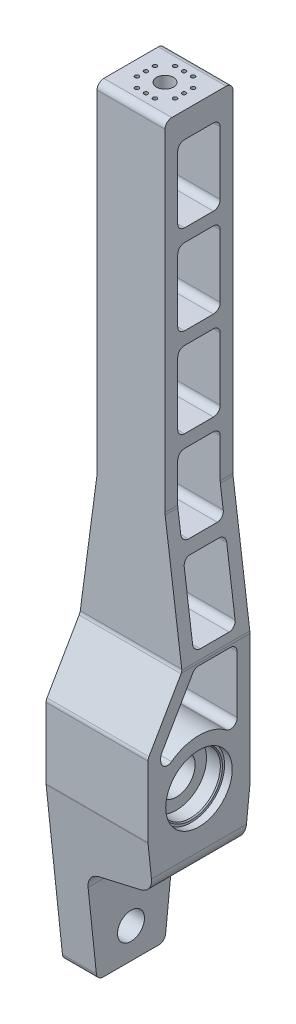
from build123d import *

# Parameters (mm, degrees)
SKETCH5_W                   = 38.1
SKETCH5_H                   = 298.45
BOSS_EXTRUDE2_DEPTH         = 19.05
F_3_8_CLEARANCE_HOLE2_D     = 10.0838
F_3_8_CLEARANCE_HOLE4_D     = 13.97
BODY_MOVE_COPY4_ANGLE       = 90
CUT_EXTRUDE7_DEPTH          = 218.574389578
CUT_EXTRUDE7_DEPTH_BACK     = 218.574389578
CUT_EXTRUDE1_DEPTH          = 218.574389578
CUT_EXTRUDE1_DEPTH_BACK     = 218.574389578
CUT_EXTRUDE5_DEPTH          = 218.574389578
CUT_EXTRUDE5_DEPTH_BACK     = 218.574389578
CUT_EXTRUDE8_DEPTH          = 218.574389578
CUT_EXTRUDE8_DEPTH_BACK     = 218.574389578
EXTRUDE_THIN1_DEPTH         = 19.05
EXTRUDE_THIN1_DEPTH_BACK    = 19.05
SKETCH27_W                  = 15.875
SKETCH27_H                  = 4.7625
CUT_EXTRUDE9_DEPTH          = 218.574389578
SKETCH31_R                  = 0.735
CUT_EXTRUDE10_DEPTH         = 12.7
CIRPATTERN1_COUNT           = 4
CIRPATTERN1_COPY_1_SKETCH_R = 0.735
CIRPATTERN1_COPY_1_DEPTH    = 12.7
CIRPATTERN1_COPY_2_SKETCH_R = 0.735
CIRPATTERN1_COPY_2_DEPTH    = 12.7
CIRPATTERN1_COPY_3_SKETCH_R = 0.735
CIRPATTERN1_COPY_3_DEPTH    = 12.7
CIRPATTERN1_COPY_4_SKETCH_R = 0.735
CIRPATTERN1_COPY_4_DEPTH    = 12.7
CIRPATTERN1_COPY_5_SKETCH_R = 0.735
CIRPATTERN1_COPY_5_DEPTH    = 12.7
CIRPATTERN1_COPY_6_SKETCH_R = 0.735
CIRPATTERN1_COPY_6_DEPTH    = 12.7
CUT_EXTRUDE11_REACH         = 287.715
SKETCH33_R                  = 3.175
FILLET4_R                   = 2.54
FILLET3_R                   = 6.35
FILLET5_R                   = 2.54


with BuildPart() as part:
    # Sketch5 → Boss-Extrude2 (new, symmetric)
    with BuildSketch(Plane.XY):
        with Locations((0, 66.675)):
            Rectangle(SKETCH5_W, SKETCH5_H)
    extrude(amount=BOSS_EXTRUDE2_DEPTH, both=True)

    # 3/8 Clearance Hole2 (through all)
    with Locations(Plane(origin=(19.05, 0, 0), x_dir=(0, 0, -1), z_dir=(1, 0, 0))):
        with Locations((0, -57.15)):
            Hole(F_3_8_CLEARANCE_HOLE2_D / 2)

    # 3/8 Clearance Hole4 (through all)
    with Locations(Plane(origin=(19.05, 0, 0), x_dir=(0, 0, -1), z_dir=(1, 0, 0))):
        with Locations((0, 0)):
            Hole(F_3_8_CLEARANCE_HOLE4_D / 2)


with BuildPart() as body_2:
    # uxcell-FR6ZZ: read off the stored shape, not the designer's step
    # uxcell-FR6ZZ outline → uxcell-FR6ZZ (revolve)
    with BuildSketch(Plane(origin=(46.870492888, 0, -67.456601715), x_dir=(1, 0, 0), z_dir=(0, 0, 1))):
        Polygon((12.430125, 146.229545606), (4.7625, 146.229545606), (4.7625, 137.815795606), (11.2395, 137.815795606), (11.2395, 142.975170606), (11.636375, 143.372045606), (12.430125, 143.372045606), align=None)
    revolve(axis=Axis((46.870492888, 0, -67.456601715), (0, 1, 0)))


with BuildPart() as body_2_1:
    # Body-Move/Copy4: read off the stored shape, not the designer's step
    # Body-Move/Copy4: moved
    add(body_2.part.moved(Location((-46.8704929, -127.1795456, 67.4566017))).rotate(Axis((0, 0, 0), (0, 0, -1)), BODY_MOVE_COPY4_ANGLE))


with BuildPart() as body_3:
    # Mirror1: mirrored copy
    add(body_2_1.part.mirror(Plane(origin=(0, 0, 0), x_dir=(0, 0, 1), z_dir=(1, 0, 0))))


with BuildPart() as part_1:
    add(part.part)

    # Combine2: cut body 3, body 2
    add(body_3.part, mode=Mode.SUBTRACT)
    add(body_2_1.part, mode=Mode.SUBTRACT)

    # Sketch24 → Cut-Extrude7 (cut, two sides: drawn at the far end of the back side and taken through both)
    with BuildSketch(Plane(origin=(0, 0, 0), x_dir=(0, 0, -1), z_dir=(1, 0, 0)).offset(-CUT_EXTRUDE7_DEPTH_BACK)):
        Polygon((-6.35, 824.957801886), (-6.35, 215.9), (-6.35, 41.047045256), (-19.05, 19.05), (-323.578900943, -508.409528806), (-1508.617276964, -226.470401495), (-1191.388376021, 1106.896929197), align=None)
    extrude(amount=CUT_EXTRUDE7_DEPTH + CUT_EXTRUDE7_DEPTH_BACK, mode=Mode.SUBTRACT)

    # Sketch11 → Cut-Extrude1 (cut, two sides: drawn at the far end of the back side and taken through both)
    with BuildSketch(Plane.XY.offset(-CUT_EXTRUDE1_DEPTH_BACK)):
        Polygon((-6.35, -691.607801887), (-6.35, -82.55), (-6.35, -31.75), (19.05, -25.4), (609.922858655, 122.318214664), (1581.067185153, -612.994182394), (964.794326498, -1426.920198945), align=None)
    extrude(amount=CUT_EXTRUDE1_DEPTH + CUT_EXTRUDE1_DEPTH_BACK, mode=Mode.SUBTRACT)

    # Sketch18 → Cut-Extrude5 (cut, two sides: drawn at the far end of the back side and taken through both)
    with BuildSketch(Plane(origin=(0, 0, 0), x_dir=(0, 0, -1), z_dir=(1, 0, 0)).offset(-CUT_EXTRUDE5_DEPTH_BACK)):
        Polygon((-67.601886726, 453.814659538), (-19.05, -8.125685716), (-12.7, -68.5419), (12.7, -68.5419), (19.05, -8.125685716), (67.601886726, 453.814659538), (67.601886726, -475.155024096), (-67.601886726, -475.155024096), align=None)
    extrude(amount=CUT_EXTRUDE5_DEPTH + CUT_EXTRUDE5_DEPTH_BACK, mode=Mode.SUBTRACT)

    # Sketch25 → Cut-Extrude8 (cut, two sides: drawn at the far end of the back side and taken through both)
    with BuildSketch(Plane(origin=(0, 0, 0), x_dir=(0, 0, -1), z_dir=(1, 0, 0)).offset(-CUT_EXTRUDE8_DEPTH_BACK)):
        with BuildLine():
            Line((14.2875, 206.375), (-1.5875, 206.375))
            Line((-1.5875, 206.375), (-1.5875, 39.770937227))
            Line((-1.5875, 39.770937227), (-14.2875, 17.773891971))
            Line((-14.2875, 17.773891971), (-14.2875, 9.563142692))
            ThreePointArc((-14.2875, 9.563142692), (0, 17.192625), (14.2875, 9.563142692))
            Line((14.2875, 9.563142692), (14.2875, 206.375))
        make_face()
    extrude(amount=CUT_EXTRUDE8_DEPTH + CUT_EXTRUDE8_DEPTH_BACK, mode=Mode.SUBTRACT)

    # Sketch27 → Extrude-Thin1 (add, two sides: drawn at the far end of the back side and taken through both)
    with BuildSketch(Plane(origin=(0, 0, 0), x_dir=(0, 0, -1), z_dir=(1, 0, 0)).offset(-EXTRUDE_THIN1_DEPTH_BACK)):
        with Locations((6.35, 175.435437445)):
            Rectangle(SKETCH27_W, SKETCH27_H)
        with Locations((6.35, 142.114624891)):
            Rectangle(SKETCH27_W, SKETCH27_H)
        with Locations((6.35, 108.793812336)):
            Rectangle(SKETCH27_W, SKETCH27_H)
        with Locations((6.35, 75.472999782)):
            Rectangle(SKETCH27_W, SKETCH27_H)
        with Locations((6.35, 42.152187227)):
            Rectangle(SKETCH27_W, SKETCH27_H)
    extrude(amount=EXTRUDE_THIN1_DEPTH + EXTRUDE_THIN1_DEPTH_BACK)

    # Sketch28 → Cut-Extrude9 (cut, symmetric)
    with BuildSketch(Plane.XY):
        Polygon((-12.7, 798.316830556), (-12.7, 215.9), (-12.7, 88.9), (-19.05, 41.047045256), (-95.664055935, -536.308695123), (-1258.253635766, -464.038874806), (-1175.289579831, 870.586650873), align=None)
    cut_extrude9 = extrude(amount=CUT_EXTRUDE9_DEPTH, both=True, mode=Mode.SUBTRACT)

    # Mirror2: Cut-Extrude9 across plane
    add(cut_extrude9.mirror(Plane(origin=(0, 0, 0), x_dir=(0, 0, 1), z_dir=(1, 0, 0))), mode=Mode.SUBTRACT)

    # Sketch31 → Cut-Extrude10 (cut)
    with BuildSketch(Plane(origin=(0, 215.9, 0), x_dir=(1, 0, 0), z_dir=(0, 1, 0))):
        with Locations(Location((-3.375, 13.475, 0), (0, 0, 180))):
            Circle(SKETCH31_R)
    cut_extrude10 = extrude(amount=-CUT_EXTRUDE10_DEPTH, mode=Mode.SUBTRACT)

    # Sketch-Pattern1: Cut-Extrude10 at 2 more places
    with Locations((3.375, 0, 0), (6.75, 0, 0)):
        add(cut_extrude10, mode=Mode.SUBTRACT)

    # CirPattern1: Cut-Extrude10 ×4 about axis
    cirpattern1_axis = Axis((0, 0, -6.35), (0, 1, 0))
    for i in range(1, CIRPATTERN1_COUNT):
        add(cut_extrude10.rotate(cirpattern1_axis, i * 360 / CIRPATTERN1_COUNT), mode=Mode.SUBTRACT)

    # CirPattern1 copy 1 sketch → CirPattern1 copy 1 (cut)
    with BuildSketch(Plane(origin=(6.35, 215.9, -9.725), x_dir=(0, 0, -1), z_dir=(0, 1, 0))):
        with Locations(Location((-3.375, 13.475, 0), (0, 0, 180))):
            Circle(CIRPATTERN1_COPY_1_SKETCH_R)
    extrude(amount=-CIRPATTERN1_COPY_1_DEPTH, mode=Mode.SUBTRACT)

    # CirPattern1 copy 2 sketch → CirPattern1 copy 2 (cut)
    with BuildSketch(Plane(origin=(-3.375, 215.9, -12.7), x_dir=(-1, 0, 0), z_dir=(0, 1, 0))):
        with Locations(Location((-3.375, 13.475, 0), (0, 0, 180))):
            Circle(CIRPATTERN1_COPY_2_SKETCH_R)
    extrude(amount=-CIRPATTERN1_COPY_2_DEPTH, mode=Mode.SUBTRACT)

    # CirPattern1 copy 3 sketch → CirPattern1 copy 3 (cut)
    with BuildSketch(Plane(origin=(-6.35, 215.9, -2.975), x_dir=(0, 0, 1), z_dir=(0, 1, 0))):
        with Locations(Location((-3.375, 13.475, 0), (0, 0, 180))):
            Circle(CIRPATTERN1_COPY_3_SKETCH_R)
    extrude(amount=-CIRPATTERN1_COPY_3_DEPTH, mode=Mode.SUBTRACT)

    # CirPattern1 copy 4 sketch → CirPattern1 copy 4 (cut)
    with BuildSketch(Plane(origin=(6.35, 215.9, -13.1), x_dir=(0, 0, -1), z_dir=(0, 1, 0))):
        with Locations(Location((-3.375, 13.475, 0), (0, 0, 180))):
            Circle(CIRPATTERN1_COPY_4_SKETCH_R)
    extrude(amount=-CIRPATTERN1_COPY_4_DEPTH, mode=Mode.SUBTRACT)

    # CirPattern1 copy 5 sketch → CirPattern1 copy 5 (cut)
    with BuildSketch(Plane(origin=(-6.75, 215.9, -12.7), x_dir=(-1, 0, 0), z_dir=(0, 1, 0))):
        with Locations(Location((-3.375, 13.475, 0), (0, 0, 180))):
            Circle(CIRPATTERN1_COPY_5_SKETCH_R)
    extrude(amount=-CIRPATTERN1_COPY_5_DEPTH, mode=Mode.SUBTRACT)

    # CirPattern1 copy 6 sketch → CirPattern1 copy 6 (cut)
    with BuildSketch(Plane(origin=(-6.35, 215.9, 0.4), x_dir=(0, 0, 1), z_dir=(0, 1, 0))):
        with Locations(Location((-3.375, 13.475, 0), (0, 0, 180))):
            Circle(CIRPATTERN1_COPY_6_SKETCH_R)
    extrude(amount=-CIRPATTERN1_COPY_6_DEPTH, mode=Mode.SUBTRACT)

    # Sketch33 → Cut-Extrude11 (cut, up to next)
    with BuildSketch(Plane(origin=(0, 215.9, 0), x_dir=(1, 0, 0), z_dir=(0, 1, 0)), mode=Mode.PRIVATE) as cut_extrude11_sk1:
        with Locations(Location((0, 6.35, 0), (0, 0, 180))):
            Circle(SKETCH33_R)
    cut_extrude11_tool1 = extrude(cut_extrude11_sk1.sketch, amount=-CUT_EXTRUDE11_REACH, mode=Mode.PRIVATE) & part_1.part
    add(cut_extrude11_tool1.solids().sort_by_distance((0, 215.9, -6.35))[0], mode=Mode.SUBTRACT)

    # Fillet4
    # the kernel refuses this fillet: 2.54 mm, written as the material it adds along each edge
    with BuildSketch(Plane(origin=(19.05, 9.563142692, -14.2875), x_dir=(0, 0.723814315950971, 0.6899948086938249), z_dir=(-1, 0, 0))) as fillet4_piece_1:
        with BuildLine():
            CenterArc((6.306533936, 2.502680089), FILLET4_R, 133.629697932, 126.536436571)
            Line((4.553947122, 4.341168451), (0, 0))
            ThreePointArc((0, 0), (2.936361244, 0.252609149), (5.872722487, 0))
        make_face()
    extrude(amount=38.1)
    with BuildSketch(Plane(origin=(19.05, 9.563142692, 14.2875), x_dir=(0, 0.7238143159509709, -0.6899948086938249), z_dir=(-1, 0, 0))) as fillet4_piece_2:
        with BuildLine():
            CenterArc((6.306533936, -2.502680089), FILLET4_R, 99.833865496, 126.536436571)
            Line((4.553947122, -4.341168451), (0, 0))
            ThreePointArc((0, 0), (2.936361244, -0.252609149), (5.872722487, 0))
        make_face()
    extrude(amount=38.1)
    with BuildSketch(Plane(origin=(19.05, 17.773891971, 14.2875), x_dir=(0, -1, 0), z_dir=(-1, 0, 0))) as fillet4_piece_3:
        with BuildLine():
            CenterArc((FILLET4_R * 0.267949192431, -FILLET4_R), FILLET4_R, 90, 30)
            Line((-FILLET4_R * 0.232050807569, -FILLET4_R * 0.133974596216), (0, 0))
            Line((0, 0), (FILLET4_R * 0.267949192431, 0))
        make_face()
    extrude(amount=38.1)
    with BuildSketch(Plane(origin=(-19.05, 39.770937227, 1.5875), x_dir=(0, -0.8660254037844383, 0.500000000000001), z_dir=(1, 0, 0))) as fillet4_piece_4:
        with BuildLine():
            CenterArc((FILLET4_R * 0.57735026919, FILLET4_R), FILLET4_R, 210, 60)
            Line((-FILLET4_R * 0.288675134595, FILLET4_R * 0.5), (0, 0))
            Line((0, 0), (FILLET4_R * 0.57735026919, 0))
        make_face()
    extrude(amount=38.1)
    with BuildSketch(Plane(origin=(-19.05, 39.770937227, -14.2875), x_dir=(0, -1.0, 1.3861178172013177e-12), z_dir=(1, 0, 0))) as fillet4_piece_5:
        with BuildLine():
            CenterArc((FILLET4_R, -FILLET4_R), FILLET4_R, 90, 90)
            Line((0, -FILLET4_R), (0, 0))
            Line((0, 0), (FILLET4_R, 0))
        make_face()
    extrude(amount=38.1)
    with BuildSketch(Plane(origin=(-12.7, 206.375, -14.2875), x_dir=(0, 0, 1), z_dir=(1, 0, 0))) as fillet4_piece_6_section:
        with BuildLine():
            CenterArc((FILLET4_R, FILLET4_R), FILLET4_R, 180, 90)
            Line((0, FILLET4_R), (0, 0))
            Line((0, 0), (FILLET4_R, 0))
        make_face()
    fillet4_piece_6 = extrude(amount=25.4, mode=Mode.PRIVATE)
    fillet4_piece_6 = fillet4_piece_6 - Plane(origin=(3.375, 206.375, -13.475), x_dir=(-1, 0, 0), z_dir=(0, 1, 0)) * Cylinder(0.735, 61, mode=Mode.PRIVATE)
    fillet4_piece_6 = fillet4_piece_6 - Plane(origin=(0, 206.375, -13.475), x_dir=(-1, 0, 0), z_dir=(0, 1, 0)) * Cylinder(0.735, 61, mode=Mode.PRIVATE)
    fillet4_piece_6 = fillet4_piece_6 - Plane(origin=(-3.375, 206.375, -13.475), x_dir=(-1, 0, 0), z_dir=(0, 1, 0)) * Cylinder(0.735, 61, mode=Mode.PRIVATE)
    add(fillet4_piece_6)
    with BuildSketch(Plane(origin=(-12.7, 206.375, 1.5875), x_dir=(0, -1, 0), z_dir=(1, 0, 0))) as fillet4_piece_7_section:
        with BuildLine():
            CenterArc((FILLET4_R, FILLET4_R), FILLET4_R, 180, 90)
            Line((0, FILLET4_R), (0, 0))
            Line((0, 0), (FILLET4_R, 0))
        make_face()
    fillet4_piece_7 = extrude(amount=25.4, mode=Mode.PRIVATE)
    fillet4_piece_7 = fillet4_piece_7 - Plane(origin=(3.375, 206.375, 0.775), x_dir=(1, 0, 0), z_dir=(0, 1, 0)) * Cylinder(0.735, 61, mode=Mode.PRIVATE)
    fillet4_piece_7 = fillet4_piece_7 - Plane(origin=(0, 206.375, 0.775), x_dir=(1, 0, 0), z_dir=(0, 1, 0)) * Cylinder(0.735, 61, mode=Mode.PRIVATE)
    fillet4_piece_7 = fillet4_piece_7 - Plane(origin=(-3.375, 206.375, 0.775), x_dir=(1, 0, 0), z_dir=(0, 1, 0)) * Cylinder(0.735, 61, mode=Mode.PRIVATE)
    add(fillet4_piece_7)
    with BuildSketch(Plane(origin=(24.937362131, 44.533437227, 1.5875), x_dir=(0, 1, 0), z_dir=(-1, 0, 0))) as fillet4_piece_8_section:
        with BuildLine():
            CenterArc((FILLET4_R, FILLET4_R), FILLET4_R, 180, 90)
            Line((0, FILLET4_R), (0, 0))
            Line((0, 0), (FILLET4_R, 0))
        make_face()
    fillet4_piece_8 = extrude(amount=49.874724262, mode=Mode.PRIVATE)
    fillet4_piece_8 = split(fillet4_piece_8, bisect_by=Plane(origin=(-17.834205847, 50.209146452, 1.5875), z_dir=(0.9913101924396583, -0.1315450583079716, 0)), keep=Keep.TOP, mode=Mode.PRIVATE)
    fillet4_piece_8 = split(fillet4_piece_8, bisect_by=Plane(origin=(18.697243181, 43.7053848, 1.5875), z_dir=(-0.9913101924396583, -0.1315450583079716, 0)), keep=Keep.TOP, mode=Mode.PRIVATE)
    add(fillet4_piece_8)
    with BuildSketch(Plane(origin=(-24.937362131, 44.533437227, -14.2875), x_dir=(0, 1.0, 1.4119938813972664e-12), z_dir=(1, 0, 0))) as fillet4_piece_9_section:
        with BuildLine():
            CenterArc((FILLET4_R, FILLET4_R), FILLET4_R, 180, 90)
            Line((0, FILLET4_R), (0, 0))
            Line((0, 0), (FILLET4_R, 0))
        make_face()
    fillet4_piece_9 = extrude(amount=49.874724262, mode=Mode.PRIVATE)
    fillet4_piece_9 = split(fillet4_piece_9, bisect_by=Plane(origin=(-18.697243181, 43.7053848, -14.2875), z_dir=(0.9913101924396583, -0.1315450583079716, 0)), keep=Keep.TOP, mode=Mode.PRIVATE)
    fillet4_piece_9 = split(fillet4_piece_9, bisect_by=Plane(origin=(17.834205847, 50.209146452, -14.2875), z_dir=(-0.9913101924396583, -0.1315450583079716, 0)), keep=Keep.TOP, mode=Mode.PRIVATE)
    add(fillet4_piece_9)
    with BuildSketch(Plane(origin=(20.51575095, 77.854249782, 1.5875), x_dir=(0, 0, -1), z_dir=(-1, 0, 0))) as fillet4_piece_10_section:
        with BuildLine():
            CenterArc((FILLET4_R, -FILLET4_R), FILLET4_R, 90, 90)
            Line((0, -FILLET4_R), (0, 0))
            Line((0, 0), (FILLET4_R, 0))
        make_face()
    fillet4_piece_10 = extrude(amount=41.0315019, mode=Mode.PRIVATE)
    fillet4_piece_10 = split(fillet4_piece_10, bisect_by=Plane(origin=(-13.565618691, 82.376785504, 1.5875), z_dir=(0.9913101924396583, -0.1315450583079716, 0)), keep=Keep.TOP, mode=Mode.PRIVATE)
    fillet4_piece_10 = split(fillet4_piece_10, bisect_by=Plane(origin=(14.275632, 77.026197354, 1.5875), z_dir=(-0.9913101924396583, -0.1315450583079716, 0)), keep=Keep.TOP, mode=Mode.PRIVATE)
    add(fillet4_piece_10)
    with BuildSketch(Plane(origin=(-20.51575095, 77.854249782, -14.2875), x_dir=(0, 1.0, 1.2021879554838809e-12), z_dir=(1, 0, 0))) as fillet4_piece_11_section:
        with BuildLine():
            CenterArc((FILLET4_R, FILLET4_R), FILLET4_R, 180, 90)
            Line((0, FILLET4_R), (0, 0))
            Line((0, 0), (FILLET4_R, 0))
        make_face()
    fillet4_piece_11 = extrude(amount=41.0315019, mode=Mode.PRIVATE)
    fillet4_piece_11 = split(fillet4_piece_11, bisect_by=Plane(origin=(-14.275632, 77.026197354, -14.2875), z_dir=(0.9913101924396583, -0.1315450583079716, 0)), keep=Keep.TOP, mode=Mode.PRIVATE)
    fillet4_piece_11 = split(fillet4_piece_11, bisect_by=Plane(origin=(13.565618691, 82.376785504, -14.2875), z_dir=(-0.9913101924396583, -0.1315450583079716, 0)), keep=Keep.TOP, mode=Mode.PRIVATE)
    add(fillet4_piece_11)
    with BuildSketch(Plane(origin=(21.147726032, 73.091749782, 1.5875), x_dir=(0, -1, 0), z_dir=(-1, 0, 0))) as fillet4_piece_12_section:
        with BuildLine():
            CenterArc((FILLET4_R, -FILLET4_R), FILLET4_R, 90, 90)
            Line((0, -FILLET4_R), (0, 0))
            Line((0, 0), (FILLET4_R, 0))
        make_face()
    fillet4_piece_12 = extrude(amount=42.295452064, mode=Mode.PRIVATE)
    fillet4_piece_12 = split(fillet4_piece_12, bisect_by=Plane(origin=(-14.17572225, 77.779107079, 1.5875), z_dir=(0.9913101924396583, -0.1315450583079716, 0)), keep=Keep.TOP, mode=Mode.PRIVATE)
    fillet4_piece_12 = split(fillet4_piece_12, bisect_by=Plane(origin=(14.907607082, 72.263697354, 1.5875), z_dir=(-0.9913101924396583, -0.1315450583079716, 0)), keep=Keep.TOP, mode=Mode.PRIVATE)
    add(fillet4_piece_12)
    with BuildSketch(Plane(origin=(-21.147726032, 73.091749782, -14.2875), x_dir=(0, 0, 1), z_dir=(1, 0, 0))) as fillet4_piece_13_section:
        with BuildLine():
            CenterArc((FILLET4_R, FILLET4_R), FILLET4_R, 180, 90)
            Line((0, FILLET4_R), (0, 0))
            Line((0, 0), (FILLET4_R, 0))
        make_face()
    fillet4_piece_13 = extrude(amount=42.295452064, mode=Mode.PRIVATE)
    fillet4_piece_13 = split(fillet4_piece_13, bisect_by=Plane(origin=(-14.907607082, 72.263697354, -14.2875), z_dir=(0.9913101924396583, -0.1315450583079716, 0)), keep=Keep.TOP, mode=Mode.PRIVATE)
    fillet4_piece_13 = split(fillet4_piece_13, bisect_by=Plane(origin=(14.17572225, 77.779107079, -14.2875), z_dir=(-0.9913101924396583, -0.1315450583079716, 0)), keep=Keep.TOP, mode=Mode.PRIVATE)
    add(fillet4_piece_13)
    with BuildSketch(Plane(origin=(12.7, 111.175062336, 1.5875), x_dir=(0, 1, 0), z_dir=(-1, 0, 0)), Plane(origin=(-12.7, 111.175062336, -14.2875), x_dir=(0, 1.0, 1.0658141036401596e-12), z_dir=(1, 0, 0)), Plane(origin=(12.7, 144.495874891, 1.5875), x_dir=(0, 1, 0), z_dir=(-1, 0, 0)), Plane(origin=(-12.7, 144.495874891, -14.2875), x_dir=(0, 1, 0), z_dir=(1, 0, 0)), Plane(origin=(-12.7, 139.733374891, -14.2875), x_dir=(0, 0, 1), z_dir=(1, 0, 0)), Plane(origin=(12.7, 177.816687445, 1.5875), x_dir=(0, 1, 0), z_dir=(-1, 0, 0)), Plane(origin=(-12.7, 177.816687445, -14.2875), x_dir=(0, 1, 0), z_dir=(1, 0, 0)), Plane(origin=(-12.7, 173.054187445, -14.2875), x_dir=(0, 0, 1), z_dir=(1, 0, 0))) as fillet4_piece_14:
        with BuildLine():
            CenterArc((FILLET4_R, FILLET4_R), FILLET4_R, 180, 90)
            Line((0, FILLET4_R), (0, 0))
            Line((0, 0), (FILLET4_R, 0))
        make_face()
    extrude(amount=25.4)
    with BuildSketch(Plane(origin=(12.7, 106.412562336, 1.5875), x_dir=(0, -1, 0), z_dir=(-1, 0, 0)), Plane(origin=(-12.7, 106.412562336, -14.2875), x_dir=(0, -1.0, 1.0860953431451051e-12), z_dir=(1, 0, 0)), Plane(origin=(12.7, 139.733374891, 1.5875), x_dir=(0, -1, 0), z_dir=(-1, 0, 0)), Plane(origin=(12.7, 173.054187445, 1.5875), x_dir=(0, -1, 0), z_dir=(-1, 0, 0))) as fillet4_piece_15:
        with BuildLine():
            CenterArc((FILLET4_R, -FILLET4_R), FILLET4_R, 90, 90)
            Line((0, -FILLET4_R), (0, 0))
            Line((0, 0), (FILLET4_R, 0))
        make_face()
    extrude(amount=25.4)

    # Fillet3
    fillet3_edges = [part_1.edges().sort_by_distance(p)[0] for p in [
        (-12.7, 88.9, -16.66875),
        (-12.7, 88.9, 3.96875),
        (-19.05, 41.047045256, -6.35),
        (12.7, 88.9, 3.96875),
        (12.7, 88.9, -16.66875),
        (19.05, 41.047045256, -6.35),
        (-6.35, -31.75, 0),
        (19.05, -25.4, 0),
    ]]
    fillet(fillet3_edges, radius=FILLET3_R)

    # Fillet5
    fillet5_edges = [part_1.edges().sort_by_distance(p)[0] for p in [
        (-12.7, -68.5419, -12.7),
        (0, -8.125685716, -19.05),
        (0, 215.9, 6.35),
        (0, 41.047045256, 6.35),
        (0, 19.05, 19.05),
        (0, -8.125685716, 19.05),
        (-12.7, -68.5419, 12.7),
        (0, 215.9, -19.05),
    ]]
    fillet(fillet5_edges, radius=FILLET5_R)


solid = part_1.part
